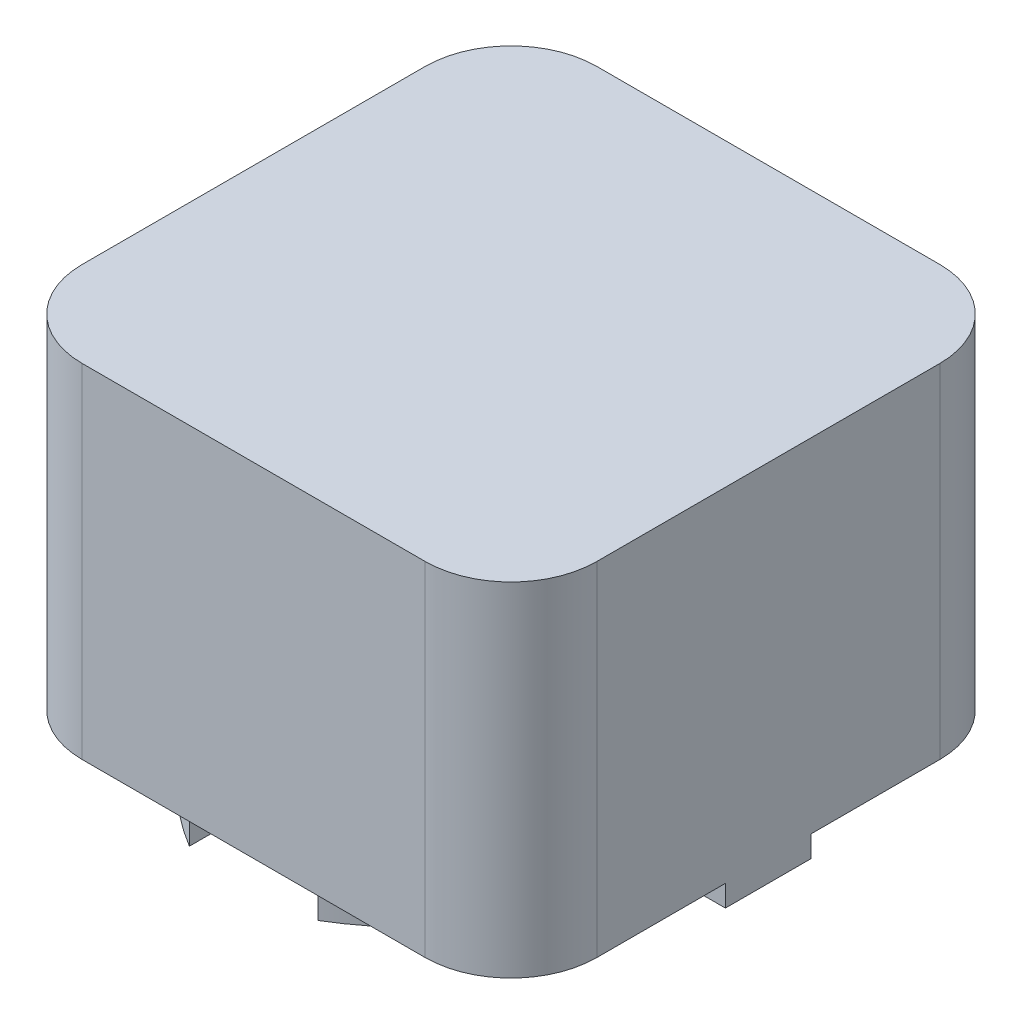
from build123d import *

# Parameters (mm, degrees)
SKETCH_2_W      = 12
SKETCH_2_H      = 12
EXTRUDE_1_DEPTH = 8
FILLET_1_R      = 2
EXTRUDE_START   = -0.5
EXTRUDE_2_DEPTH = 0.5
SKETCH_4_W      = 2
SKETCH_4_H      = 2
EXTRUDE_3_DEPTH = 0.5


# Read off the part's stored shape, not the designer's step: Бобышка-Вытянуть2
with BuildPart() as part:
    # Эскиз2 → Бобышка-Вытянуть1 (new body)
    with BuildSketch(Plane(origin=(0, 0, 0), x_dir=(1, 0, 0), z_dir=(0, 1, 0))):
        Rectangle(SKETCH_2_W, SKETCH_2_H)
    extrude(amount=EXTRUDE_1_DEPTH)

    # Скругление1
    fillet_1_edges = [part.edges().sort_by_distance(p)[0] for p in [
        (-6, 4, -6),
        (6, 4, -6),
        (6, 4, 6),
        (-6, 4, 6),
    ]]
    fillet(fillet_1_edges, radius=FILLET_1_R)

    # Бобышка-Вытянуть2 outline → Бобышка-Вытянуть2 (add)
    with BuildSketch(Plane(origin=(0, 0, 0), x_dir=(1, 0, 0), z_dir=(0, 1, 0)).offset(EXTRUDE_START)):
        with BuildLine():
            Line((-1.5, -6), (-1.5, 6))
            ThreePointArc((-1.5, 6), (-4.894448725, 0), (-1.5, -6))
        make_face()
        with BuildLine():
            Line((1.5, 6), (1.5, -6))
            ThreePointArc((1.5, -6), (4.894448725, 0), (1.5, 6))
        make_face()
    extrude(amount=EXTRUDE_2_DEPTH)

    # Эскиз4 → Бобышка-Вытянуть3 (add)
    with BuildSketch(Plane.XZ):
        with Locations((-5, 0)):
            Rectangle(SKETCH_4_W, SKETCH_4_H)
        with Locations((5, 0)):
            Rectangle(SKETCH_4_W, SKETCH_4_H)
    extrude(amount=EXTRUDE_3_DEPTH)


solid = part.part
